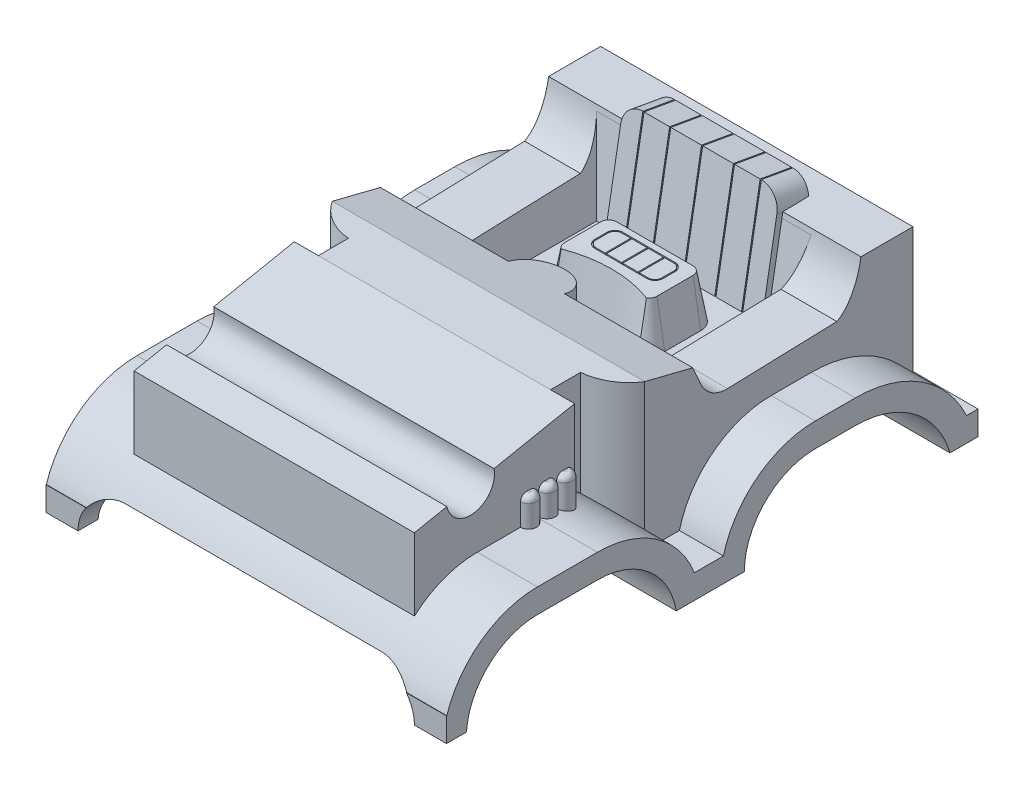
from build123d import *

# Parameters (mm, degrees)
BOSS_EXTRUDE1_DEPTH      = 2540
CUT_EXTRUDE1_REACH       = 4266.056
CUT_EXTRUDE1_END_RADIUS  = 451.071428571
BOSS_EXTRUDE2_START      = -150.904168
SKETCH3_W                = 1778
SKETCH3_H                = 1016
BOSS_EXTRUDE2_DEPTH      = 658.904168
SKETCH4_R                = 152.4
CUT_EXTRUDE2_DEPTH       = 4147.833939336
BOSS_EXTRUDE3_START      = -38.849559
SKETCH3_3_R              = 50.8
BOSS_EXTRUDE3_DEPTH      = 216.649559
FILLET1_R                = 38.1
BOSS_EXTRUDE4_START      = -2260.6
BOSS_EXTRUDE4_DEPTH      = 1981.2
BOSS_EXTRUDE4_START_2    = 229.763140218
BOSS_EXTRUDE4_2_DEPTH    = 850.636859782
BOSS_EXTRUDE4_3_DEPTH    = 1981.2
CUT_EXTRUDE3_DEPTH       = 4201.626510494
SKETCH7_W                = 1371.6
SKETCH7_H                = 1066.8
CUT_EXTRUDE4_DEPTH       = 584.2
CUT_EXTRUDE4_DRAFT       = -10
BOSS_EXTRUDE5_DEPTH      = 38.1
BOSS_EXTRUDE5_DEPTH_BACK = 165.1
BOSS_EXTRUDE6_DEPTH      = 38.1
BOSS_EXTRUDE6_DRAFT      = -10
SKETCH11_W               = 7.62
SKETCH11_H               = 680.867293906
CUT_EXTRUDE5_DEPTH       = 7.62
SKETCH12_W               = 7.62
SKETCH12_H               = 195.58
CUT_EXTRUDE6_DEPTH       = 7.62
BOSS_EXTRUDE8_DEPTH      = 279.4
BOSS_EXTRUDE8_DRAFT      = 10
SKETCH14_W               = 96.52
SKETCH14_H               = 162.56
CUT_EXTRUDE7_DEPTH       = 7.62
BOSS_EXTRUDE9_REACH      = 4282.354
SKETCH15_R               = 177.8
SCALE1_SCALE             = 0.0393701


with BuildPart() as part:
    # Sketch1 → Boss-Extrude1 (new body)
    with BuildSketch(Plane(origin=(0, 0, 0), x_dir=(0, 0, -1), z_dir=(1, 0, 0))):
        with BuildLine():
            Line((0, 0), (127, 0))
            ThreePointArc((127, 0), (269.22573207, 298.68671564), (577, 420))
            Line((577, 420), (958, 420))
            ThreePointArc((958, 420), (1284.496554346, 301.067326603), (1458, 0))
            Line((1458, 0), (1889.8, 0))
            ThreePointArc((1889.8, 0), (2021.601948466, 318.198051534), (2339.8, 450))
            Line((2339.8, 450), (2593.8, 450))
            ThreePointArc((2593.8, 450), (2968.8, 325), (3193.8, 0))
            Line((3193.8, 0), (3371.6, 0))
            Line((3371.6, 0), (3371.6, 152.4))
            Line((3371.6, 152.4), (3298.89573818, 152.4))
            ThreePointArc((3298.89573818, 152.4), (3012.028406496, 480.313482236), (2593.8, 602.4))
            Line((2593.8, 602.4), (2339.8, 602.4))
            ThreePointArc((2339.8, 602.4), (1971.642425041, 476.807885841), (1756.996431034, 152.4))
            Line((1756.996431034, 152.4), (1572.830057821, 152.4))
            ThreePointArc((1572.830057821, 152.4), (1330.295581494, 457.377414039), (958, 572.4))
            Line((958, 572.4), (577, 572.4))
            ThreePointArc((577, 572.4), (221.009831596, 456.215719938), (2.094790422, 152.4))
            Line((2.094790422, 152.4), (0, 152.4))
            Line((0, 152.4), (0, 0))
        make_face()
    extrude(amount=-BOSS_EXTRUDE1_DEPTH)

    # Cut-Extrude1: up to this cylinder (the profile starts outside it)
    cut_extrude1_end = Plane(origin=(-1270, -31.071428571, -577), z_dir=(1, 0, 0)) * Cylinder(CUT_EXTRUDE1_END_RADIUS, 10596.065627143, mode=Mode.PRIVATE)
    # Sketch2 → Cut-Extrude1 (cut, up to the surface)
    with BuildSketch(Plane.XY, mode=Mode.PRIVATE) as cut_extrude1_sk1:
        with BuildLine():
            Line((-1270, 152.4), (-2286, 152.4))
            ThreePointArc((-2286, 152.4), (-2323.765557705, 80.321852568), (-2336.8, 0))
            Line((-2336.8, 0), (-2540, 0))
            Line((-2540, 0), (-2540, -127))
            Line((-2540, -127), (-1270, -127))
            Line((-1270, -127), (-1270, 152.4))
        make_face()
    cut_extrude1_tool1 = extrude(cut_extrude1_sk1.sketch, amount=-CUT_EXTRUDE1_REACH, mode=Mode.PRIVATE) - cut_extrude1_end
    add(cut_extrude1_tool1.solids().sort_by_distance((-1850.405385, 5.795419, 0))[0], mode=Mode.SUBTRACT)
    # Sketch2 → Cut-Extrude1 (cut, up to the surface)
    with BuildSketch(Plane.XY, mode=Mode.PRIVATE) as cut_extrude1_sk2:
        with BuildLine():
            Line((-1270, 254), (-2082.8, 254))
            ThreePointArc((-2082.8, 254), (-2196.392253257, 227.184506514), (-2286, 152.4))
            Line((-2286, 152.4), (-1270, 152.4))
            Line((-1270, 152.4), (-1270, 254))
        make_face()
    cut_extrude1_tool2 = extrude(cut_extrude1_sk2.sketch, amount=-CUT_EXTRUDE1_REACH, mode=Mode.PRIVATE) - cut_extrude1_end
    add(cut_extrude1_tool2.solids().sort_by_distance((-1748.558566, 201.806149, 0))[0], mode=Mode.SUBTRACT)
    # Sketch2 → Cut-Extrude1 (cut, up to the surface)
    with BuildSketch(Plane.XY, mode=Mode.PRIVATE) as cut_extrude1_sk3:
        with BuildLine():
            Line((-457.2, 254), (-1270, 254))
            Line((-1270, 254), (-1270, 152.4))
            Line((-1270, 152.4), (-254, 152.4))
            ThreePointArc((-254, 152.4), (-343.607746743, 227.184506514), (-457.2, 254))
        make_face()
    cut_extrude1_tool3 = extrude(cut_extrude1_sk3.sketch, amount=-CUT_EXTRUDE1_REACH, mode=Mode.PRIVATE) - cut_extrude1_end
    add(cut_extrude1_tool3.solids().sort_by_distance((-791.441434, 201.806149, 0))[0], mode=Mode.SUBTRACT)
    # Sketch2 → Cut-Extrude1 (cut, up to the surface)
    with BuildSketch(Plane.XY, mode=Mode.PRIVATE) as cut_extrude1_sk4:
        with BuildLine():
            Line((-254, 152.4), (-1270, 152.4))
            Line((-1270, 152.4), (-1270, -127))
            Line((-1270, -127), (0, -127))
            Line((0, -127), (0, 0))
            Line((0, 0), (-203.2, 0))
            ThreePointArc((-203.2, 0), (-216.234442295, 80.321852568), (-254, 152.4))
        make_face()
    cut_extrude1_tool4 = extrude(cut_extrude1_sk4.sketch, amount=-CUT_EXTRUDE1_REACH, mode=Mode.PRIVATE) - cut_extrude1_end
    add(cut_extrude1_tool4.solids().sort_by_distance((-689.594615, 5.795419, 0))[0], mode=Mode.SUBTRACT)

    # Sketch3 → Boss-Extrude2 (add)
    with BuildSketch(Plane(origin=(0, 572.4, 0), x_dir=(1, 0, 0), z_dir=(0, 1, 0)).offset(BOSS_EXTRUDE2_START)):
        with Locations((-1270, 685.8)):
            Rectangle(SKETCH3_W, SKETCH3_H)
    extrude(amount=BOSS_EXTRUDE2_DEPTH)

    # Sketch4 → Cut-Extrude2 (cut, through all)
    with BuildSketch(Plane(origin=(-381, 0, 0), x_dir=(0, 0, -1), z_dir=(1, 0, 0))):
        with Locations((533.4, 949.292290628)):
            Circle(SKETCH4_R)
        Polygon((685.8, 979.547915868), (1193.8, 1080.4), (177.8, 1080.4), (177.8, 878.695831736), align=None)
    extrude(amount=-CUT_EXTRUDE2_DEPTH, mode=Mode.SUBTRACT)

    # Sketch3<3> → Boss-Extrude3 (add)
    with BuildSketch(Plane(origin=(0, 572.4, 0), x_dir=(1, 0, 0), z_dir=(0, 1, 0)).offset(BOSS_EXTRUDE3_START)):
        with Locations((-381, 1130.3)):
            Circle(SKETCH3_3_R)
        with Locations((-381, 1016)):
            Circle(SKETCH3_3_R)
        with Locations((-381, 901.7)):
            Circle(SKETCH3_3_R)
        with Locations((-2159, 901.7)):
            Circle(SKETCH3_3_R)
        with Locations((-2159, 1016)):
            Circle(SKETCH3_3_R)
        with Locations((-2159, 1130.3)):
            Circle(SKETCH3_3_R)
    extrude(amount=BOSS_EXTRUDE3_DEPTH)

    # Fillet1
    fillet1_edges = [part.edges().sort_by_distance(p)[0] for p in [
        (-330.2, 750.2, -1016),
        (-2209.8, 750.2, -1016),
        (-2209.8, 750.2, -1130.3),
        (-2209.8, 750.2, -901.7),
        (-330.2, 750.2, -901.7),
        (-330.2, 750.2, -1130.3),
    ]]
    fillet(fillet1_edges, radius=FILLET1_R)

    # Boss-Extrude4: read off the stored shape, not the designer's step
    # Boss-Extrude4 outline → Boss-Extrude4 (add)
    with BuildSketch(Plane.YZ.offset(BOSS_EXTRUDE4_START)):
        with BuildLine():
            ThreePointArc((602.4, -2593.8), (511.316854835, -2958.93002447), (259.410715798, -3238.5))
            Line((259.410715798, -3238.5), (1080.4, -3238.5))
            Line((1080.4, -3238.5), (1080.4, -1193.8))
            Line((1080.4, -1193.8), (528.841416012, -1193.8))
            ThreePointArc((528.841416012, -1193.8), (380.68132018, -1423.102041212), (152.4, -1572.830057821))
            Line((152.4, -1572.830057821), (152.4, -1756.996431034))
            ThreePointArc((152.4, -1756.996431034), (476.807885841, -1971.642425041), (602.4, -2339.8))
            Line((602.4, -2339.8), (602.4, -2593.8))
        make_face()
    extrude(amount=BOSS_EXTRUDE4_DEPTH)

    # Boss-Extrude4 2 outline → Boss-Extrude4 2 (cut)
    with BuildSketch(Plane(origin=(0, 0, 0), x_dir=(1, 0, 0), z_dir=(0, 1, 0)).offset(BOSS_EXTRUDE4_START_2)):
        with BuildLine():
            Line((-2260.6, 1193.8), (-2006.6, 1193.8))
            Line((-2006.6, 1193.8), (-2006.6, 1384.3))
            ThreePointArc((-2006.6, 1384.3), (-2151.35394981, 1430.91008365), (-2260.6, 1536.7))
            Line((-2260.6, 1536.7), (-2260.6, 1193.8))
        make_face()
        with BuildLine():
            Line((-533.4, 1193.8), (-279.4, 1193.8))
            Line((-279.4, 1193.8), (-279.4, 1536.7))
            ThreePointArc((-279.4, 1536.7), (-388.64605019, 1430.91008365), (-533.4, 1384.3))
            Line((-533.4, 1384.3), (-533.4, 1193.8))
        make_face()
    extrude(amount=BOSS_EXTRUDE4_2_DEPTH, mode=Mode.SUBTRACT)

    # Boss-Extrude4 3 outline → Boss-Extrude4 3 (add)
    with BuildSketch(Plane.YZ.offset(BOSS_EXTRUDE4_START)):
        with BuildLine():
            Line((229.763140218, -1354.163658542), (229.763140241, -1536.700000042))
            ThreePointArc((229.763140241, -1536.700000042), (409.784839522, -1391.836969698), (528.841416012, -1193.8))
            Line((528.841416012, -1193.8), (361.908991001, -1193.8))
            ThreePointArc((361.908991001, -1193.8), (304.129531965, -1280.815965992), (229.763140218, -1354.163658542))
        make_face()
    extrude(amount=BOSS_EXTRUDE4_3_DEPTH)

    # Sketch6 → Cut-Extrude3 (cut, through all)
    with BuildSketch(Plane(origin=(-279.4, 0, 0), x_dir=(0, 0, -1), z_dir=(1, 0, 0))):
        with BuildLine():
            Line((1536.7, 1080.4), (1841.5, 1004.2))
            Line((1841.5, 1004.2), (1894.550853096, 884.835580533))
            ThreePointArc((1894.550853096, 884.835580533), (1962.481321528, 806.467982514), (2062.580085414, 779.333752669))
            Line((2062.580085414, 779.333752669), (2755.9, 801))
            add(Edge.make_bspline(
                [(2755.9, 801), (2876.254284598, 863.522206142), (2908.3, 1080.4)],
                knots=[0, 0, 0, 1, 1, 1], degree=2, weights=[1, 0.820658339, 1]))
            Line((2908.3, 1080.4), (1536.7, 1080.4))
        make_face()
    extrude(amount=-CUT_EXTRUDE3_DEPTH, mode=Mode.SUBTRACT)


with BuildPart() as cut_extrude4_tool:
    # Sketch7 → Cut-Extrude4 (with draft: the straight prism first)
    with BuildSketch(Plane(origin=(0, 1080.4, 0), x_dir=(1, 0, 0), z_dir=(0, 1, 0))):
        with Locations((-1270, 2374.9)):
            Rectangle(SKETCH7_W, SKETCH7_H)
    extrude(amount=-CUT_EXTRUDE4_DEPTH)
    # Cut-Extrude4: the draft: its side faces are tilted about the plane it starts from
    cut_extrude4_sides = [cut_extrude4_tool.faces().sort_by_distance(p)[0] for p in [
        (-1955.8, 788.3, -2374.9),
        (-1270, 788.3, -1841.5),
        (-584.2, 788.3, -2374.9),
        (-1270, 788.3, -2908.3),
    ]]
    draft(cut_extrude4_sides, Plane(origin=(0, 1080.4, 0), x_dir=(1, 0, 0), z_dir=(0, 1, 0)), CUT_EXTRUDE4_DRAFT)


with BuildPart() as part_1:
    add(part.part)

    # Cut-Extrude4: cut by cut_extrude4_tool
    add(cut_extrude4_tool.part, mode=Mode.SUBTRACT)

    # Sketch8 → Boss-Extrude5 (add, two sides: drawn at the far end of the back side and taken through both)
    with BuildSketch(Plane(origin=(0, -464.770545166, -2635.844743091), x_dir=(1, 0, 0), z_dir=(0, 0.17364817766693058, 0.9848077530122081)).offset(-BOSS_EXTRUDE5_DEPTH_BACK)):
        with BuildLine():
            Line((-1645.67523681, 1688.632054653), (-894.32476319, 1688.632054653))
            ThreePointArc((-894.32476319, 1688.632054653), (-809.73728194, 1653.594772713), (-774.7, 1569.007291463))
            Line((-774.7, 1569.007291463), (-774.7, 975.795064799))
            Line((-774.7, 975.795064799), (-1765.3, 975.795064799))
            Line((-1765.3, 975.795064799), (-1765.3, 1569.007291463))
            ThreePointArc((-1765.3, 1569.007291463), (-1730.26271806, 1653.594772713), (-1645.67523681, 1688.632054653))
        make_face()
    extrude(amount=BOSS_EXTRUDE5_DEPTH + BOSS_EXTRUDE5_DEPTH_BACK)


with BuildPart() as boss_extrude6_tool:
    # Sketch9 → Boss-Extrude6 (with draft: the straight prism first)
    with BuildSketch(Plane(origin=(0, 496.2, 0), x_dir=(1, 0, 0), z_dir=(0, 1, 0))):
        with BuildLine():
            Line((-1852.78977787, 2805.28977787), (-1852.78977787, 2140.375554148))
            Line((-1852.78977787, 2140.375554148), (-1814.68977787, 2132.76860248))
            ThreePointArc((-1814.68977787, 2132.76860248), (-1270, 2078.924253639), (-725.31022213, 2132.76860248))
            Line((-725.31022213, 2132.76860248), (-687.21022213, 2140.375554148))
            Line((-687.21022213, 2140.375554148), (-687.21022213, 2805.28977787))
            Line((-687.21022213, 2805.28977787), (-1852.78977787, 2805.28977787))
        make_face()
    extrude(amount=BOSS_EXTRUDE6_DEPTH)
    # Boss-Extrude6: the draft: its side faces are tilted about the plane it starts from
    boss_extrude6_sides = [boss_extrude6_tool.faces().sort_by_distance(p)[0] for p in [
        (-1852.78977787, 515.25, -2472.832666009),
        (-1833.73977787, 515.25, -2136.572078314),
        (-1270, 515.25, -2078.924253639),
        (-706.26022213, 515.25, -2136.572078314),
        (-687.21022213, 515.25, -2472.832666009),
        (-1270, 515.25, -2805.28977787),
    ]]
    draft(boss_extrude6_sides, Plane(origin=(0, 496.2, 0), x_dir=(1, 0, 0), z_dir=(0, 1, 0)), BOSS_EXTRUDE6_DRAFT)


with BuildPart() as part_2:
    add(part_1.part)

    # Boss-Extrude6: add boss_extrude6_tool
    add(boss_extrude6_tool.part)

    # Sketch11 → Cut-Extrude5 (cut)
    with BuildSketch(Plane(origin=(0, -458.154549596, -2598.323567702), x_dir=(1, 0, 0), z_dir=(0, 0.1736481776669306, 0.9848077530122081))):
        with Locations((-1641.86523681, 1348.1984077)):
            Rectangle(SKETCH11_W, SKETCH11_H)
        with Locations((-1472.19323681, 1348.1984077)):
            Rectangle(SKETCH11_W, SKETCH11_H)
        with Locations((-1270, 1348.1984077)):
            Rectangle(SKETCH11_W, SKETCH11_H)
        with Locations((-1067.80676319, 1348.1984077)):
            Rectangle(SKETCH11_W, SKETCH11_H)
        with Locations((-898.13476319, 1348.1984077)):
            Rectangle(SKETCH11_W, SKETCH11_H)
    extrude(amount=-CUT_EXTRUDE5_DEPTH, mode=Mode.SUBTRACT)

    # Sketch12 → Cut-Extrude6 (cut)
    with BuildSketch(Plane(origin=(0, 1662.977939407, -293.22787904), x_dir=(1, 0, 0), z_dir=(0, 0.9848077530122081, -0.17364817766693055))):
        with Locations((-1641.86523681, 2743.816896934)):
            Rectangle(SKETCH12_W, SKETCH12_H)
        with Locations((-1472.19323681, 2743.816896934)):
            Rectangle(SKETCH12_W, SKETCH12_H)
        with Locations((-1270, 2743.816896934)):
            Rectangle(SKETCH12_W, SKETCH12_H)
        with Locations((-1067.80676319, 2743.816896934)):
            Rectangle(SKETCH12_W, SKETCH12_H)
        with Locations((-898.13476319, 2743.816896934)):
            Rectangle(SKETCH12_W, SKETCH12_H)
    extrude(amount=-CUT_EXTRUDE6_DEPTH, mode=Mode.SUBTRACT)


with BuildPart() as boss_extrude8_tool:
    # Sketch13 → Boss-Extrude8 (with draft: the straight prism first)
    with BuildSketch(Plane(origin=(0, 534.3, 0), x_dir=(1, 0, 0), z_dir=(0, 1, 0))):
        with BuildLine():
            Line((-1028.7, 2642.022167781), (-1511.3, 2642.022167781))
            ThreePointArc((-1511.3, 2642.022167781), (-1583.142048969, 2612.264216749), (-1612.9, 2540.422167781))
            Line((-1612.9, 2540.422167781), (-1612.9, 2311.822167781))
            ThreePointArc((-1612.9, 2311.822167781), (-1593.020249751, 2251.453626465), (-1541.160614555, 2214.709327752))
            ThreePointArc((-1541.160614555, 2214.709327752), (-1270, 2268.431296854), (-998.839385445, 2214.709327752))
            ThreePointArc((-998.839385445, 2214.709327752), (-946.979750249, 2251.453626465), (-927.1, 2311.822167781))
            Line((-927.1, 2311.822167781), (-927.1, 2540.422167781))
            ThreePointArc((-927.1, 2540.422167781), (-956.857951031, 2612.264216749), (-1028.7, 2642.022167781))
        make_face()
    extrude(amount=BOSS_EXTRUDE8_DEPTH)
    # Boss-Extrude8: the draft: its side faces are tilted about the plane it starts from
    boss_extrude8_sides = [boss_extrude8_tool.faces().sort_by_distance(p)[0] for p in [
        (-956.857951031, 674, -2612.264216749),
        (-1270, 674, -2642.022167781),
        (-1583.142048969, 674, -2612.264216749),
        (-1612.9, 674, -2426.122167781),
        (-1593.020249751, 674, -2251.453626465),
        (-1270, 674, -2268.431296854),
        (-946.979750249, 674, -2251.453626465),
        (-927.1, 674, -2426.122167781),
    ]]
    draft(boss_extrude8_sides, Plane(origin=(0, 534.3, 0), x_dir=(1, 0, 0), z_dir=(0, 1, 0)), BOSS_EXTRUDE8_DRAFT)


with BuildPart() as part_3:
    add(part_2.part)

    # Boss-Extrude8: add boss_extrude8_tool
    add(boss_extrude8_tool.part)

    # Sketch14 → Cut-Extrude7 (cut)
    with BuildSketch(Plane(origin=(0, 813.7, 0), x_dir=(1, 0, 0), z_dir=(0, 1, 0))):
        with BuildLine():
            ThreePointArc((-1104.9, 2376.856409371), (-1068.978975516, 2391.735384887), (-1054.1, 2427.656409371))
            Line((-1054.1, 2427.656409371), (-1054.1, 2503.856409371))
            ThreePointArc((-1054.1, 2503.856409371), (-1068.978975516, 2539.777433855), (-1104.9, 2554.656409371))
            Line((-1104.9, 2554.656409371), (-1435.1, 2554.656409371))
            ThreePointArc((-1435.1, 2554.656409371), (-1471.021024484, 2539.777433855), (-1485.9, 2503.856409371))
            Line((-1485.9, 2503.856409371), (-1485.9, 2427.656409371))
            ThreePointArc((-1485.9, 2427.656409371), (-1471.021024484, 2391.735384887), (-1435.1, 2376.856409371))
            Line((-1435.1, 2376.856409371), (-1104.9, 2376.856409371))
        make_face()
        with BuildLine():
            ThreePointArc((-1435.1, 2384.476409371), (-1465.632870812, 2397.123538559), (-1478.28, 2427.656409371))
            Line((-1478.28, 2427.656409371), (-1478.28, 2503.856409371))
            ThreePointArc((-1478.28, 2503.856409371), (-1465.632870812, 2534.389280183), (-1435.1, 2547.036409371))
            Line((-1435.1, 2547.036409371), (-1377.95, 2547.036409371))
            Line((-1377.95, 2547.036409371), (-1377.95, 2384.476409371))
            Line((-1377.95, 2384.476409371), (-1435.1, 2384.476409371))
        make_face(mode=Mode.SUBTRACT)
        with Locations((-1322.07, 2465.756409371)):
            Rectangle(SKETCH14_W, SKETCH14_H, mode=Mode.SUBTRACT)
        with Locations((-1217.93, 2465.756409371)):
            Rectangle(SKETCH14_W, SKETCH14_H, mode=Mode.SUBTRACT)
        with BuildLine():
            Line((-1104.9, 2384.476409371), (-1162.05, 2384.476409371))
            Line((-1162.05, 2384.476409371), (-1162.05, 2547.036409371))
            Line((-1162.05, 2547.036409371), (-1104.9, 2547.036409371))
            ThreePointArc((-1104.9, 2547.036409371), (-1074.367129188, 2534.389280183), (-1061.72, 2503.856409371))
            Line((-1061.72, 2503.856409371), (-1061.72, 2427.656409371))
            ThreePointArc((-1061.72, 2427.656409371), (-1074.367129188, 2397.123538559), (-1104.9, 2384.476409371))
        make_face(mode=Mode.SUBTRACT)
    extrude(amount=-CUT_EXTRUDE7_DEPTH, mode=Mode.SUBTRACT)

    # Boss-Extrude9: up to this plane
    boss_extrude9_end = Plane(origin=(-2540, 1080.4, -1536.7), z_dir=(0, -0.9701425001453317, 0.2425356250363338))
    # Sketch15 → Boss-Extrude9 (add, up to the surface)
    with BuildSketch(Plane(origin=(0, 496.2, 0), x_dir=(1, 0, 0), z_dir=(0, 1, 0)), mode=Mode.PRIVATE) as boss_extrude9_sk1:
        with Locations((-1270, 1842.91022213)):
            Circle(SKETCH15_R)
    boss_extrude9_tool1 = split(extrude(boss_extrude9_sk1.sketch, amount=BOSS_EXTRUDE9_REACH, mode=Mode.PRIVATE), bisect_by=boss_extrude9_end, keep=Keep.BOTH, mode=Mode.PRIVATE)
    add(boss_extrude9_tool1.solids().sort_by_distance((-1270, 496.2, -1842.910222))[0])


with BuildPart() as part_4:
    # Scale1: scaled about (0, 0, 0)
    add(part_3.part.scale(SCALE1_SCALE))


solid = part_4.part
